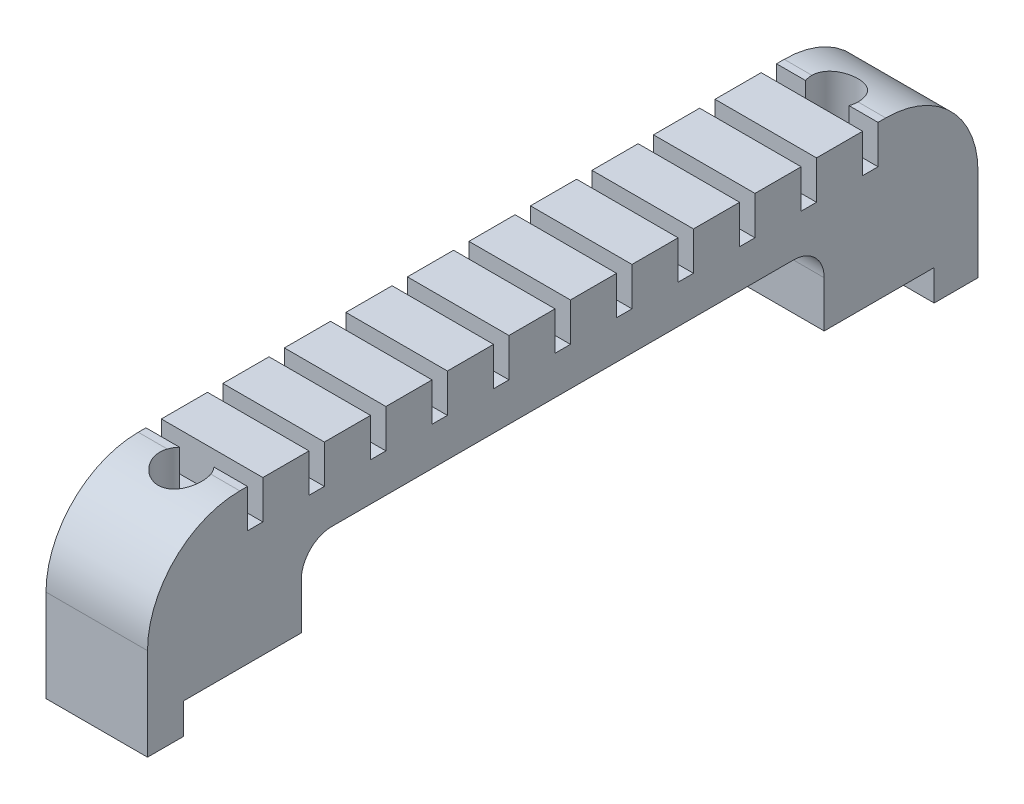
from build123d import *

# Parameters (mm, degrees)
SKETCH_1_W          = 6.6
SKETCH_1_H          = 54
SKETCH_1_R          = 1.49999954
EXTRUDE_1_DEPTH     = 12
FILLET_1_R          = 6
SKETCH_2_W          = 34
SKETCH_2_H          = 14
CUT_EXTRUDE_1_DEPTH = 20
FILLET_2_R          = 2
SKETCH_3_W          = 1
SKETCH_3_H          = 2.5
CUT_EXTRUDE_2_DEPTH = 31.274742098
SKETCH_4_W          = 14.557801868
SKETCH_4_H          = 48.8
CUT_EXTRUDE_3_DEPTH = 2
SKETCH_6_R          = 1.5
SKETCH_6_R_2        = 1
SKETCH_6_R_3        = 1.49999954
EXTRUDE_2_DEPTH     = 4


with BuildPart() as part:
    # 草图1 → 凸台-拉伸1 (new body)
    with BuildSketch(Plane(origin=(0, 0, 0), x_dir=(1, 0, 0), z_dir=(0, 1, 0))):
        with Locations((-25, 0)):
            Rectangle(SKETCH_1_W, SKETCH_1_H)
        with Locations(Location((-25, -21.49999992, 0), (0, 0, 270))):
            Circle(SKETCH_1_R, mode=Mode.SUBTRACT)
        with Locations(Location((-25, 20.9999989, 0), (0, 0, 270))):
            Circle(SKETCH_1_R, mode=Mode.SUBTRACT)
    extrude(amount=EXTRUDE_1_DEPTH)

    # 圆角1
    # the kernel refuses this fillet: 6 mm, written as the material it takes off along each edge
    with BuildSketch(Plane(origin=(-6.7, 12, 27), x_dir=(0, -1, 0), z_dir=(-1, 0, 0)), Plane(origin=(-43.3, 12, -27), x_dir=(0, -1, 0), z_dir=(1, 0, 0))) as fillet_1_piece_1:
        with BuildLine():
            CenterArc((FILLET_1_R, -FILLET_1_R), FILLET_1_R, 90, 90)
            Line((0, -FILLET_1_R), (0, 0))
            Line((0, 0), (FILLET_1_R, 0))
        make_face()
    extrude(amount=36.6, mode=Mode.SUBTRACT)

    # 草图2 → 切除-拉伸1 (cut)
    with BuildSketch(Plane.ZY.offset(28.3)):
        Rectangle(SKETCH_2_W, SKETCH_2_H)
    extrude(amount=-CUT_EXTRUDE_1_DEPTH, mode=Mode.SUBTRACT)

    # 圆角2
    fillet_2_edges = [part.edges().sort_by_distance(p)[0] for p in [
        (-25, 7, 17),
        (-25, 7, -17),
    ]]
    fillet(fillet_2_edges, radius=FILLET_2_R)

    # 草图3 → 切除-拉伸2 (cut, through all)
    with BuildSketch(Plane.ZY.offset(28.3)):
        with Locations((0, 10.75)):
            Rectangle(SKETCH_3_W, SKETCH_3_H)
        with Locations((4, 10.75)):
            Rectangle(SKETCH_3_W, SKETCH_3_H)
        with Locations((8, 10.75)):
            Rectangle(SKETCH_3_W, SKETCH_3_H)
        with Locations((12, 10.75)):
            Rectangle(SKETCH_3_W, SKETCH_3_H)
        with Locations((16, 10.75)):
            Rectangle(SKETCH_3_W, SKETCH_3_H)
        with Locations((20, 10.75)):
            Rectangle(SKETCH_3_W, SKETCH_3_H)
        with Locations((-4, 10.75)):
            Rectangle(SKETCH_3_W, SKETCH_3_H)
        with Locations((-8, 10.75)):
            Rectangle(SKETCH_3_W, SKETCH_3_H)
        with Locations((-12, 10.75)):
            Rectangle(SKETCH_3_W, SKETCH_3_H)
        with Locations((-16, 10.75)):
            Rectangle(SKETCH_3_W, SKETCH_3_H)
        with Locations((-20, 10.75)):
            Rectangle(SKETCH_3_W, SKETCH_3_H)
    extrude(amount=-CUT_EXTRUDE_2_DEPTH, mode=Mode.SUBTRACT)

    # 草图4 → 切除-拉伸3 (cut)
    with BuildSketch(Plane.XZ):
        with Locations((-25, 0.25000051)):
            Rectangle(SKETCH_4_W, SKETCH_4_H)
    extrude(amount=-CUT_EXTRUDE_3_DEPTH, mode=Mode.SUBTRACT)

    # 草图6 → 凸台-拉伸2 (add)
    # profile 1 of 2: a face of its own
    with BuildSketch(Plane.XZ.offset(-2)):
        with Locations(Location((-25, 21.49999992, 0), (0, 0, 270))):
            Circle(SKETCH_6_R)
        with Locations(Location((-25, 21.49999992, 0), (0, 0, 270))):
            Circle(SKETCH_6_R_2, mode=Mode.SUBTRACT)
    # profile 2 of 2: a face of its own
    with BuildSketch(Plane.XZ.offset(-2)):
        with Locations(Location((-25, -20.9999989, 0), (0, 0, 270))):
            Circle(SKETCH_6_R_3)
        with Locations(Location((-25, -20.9999989, 0), (0, 0, 270))):
            Circle(SKETCH_6_R_2, mode=Mode.SUBTRACT)
    extrude(amount=-EXTRUDE_2_DEPTH)


solid = part.part
